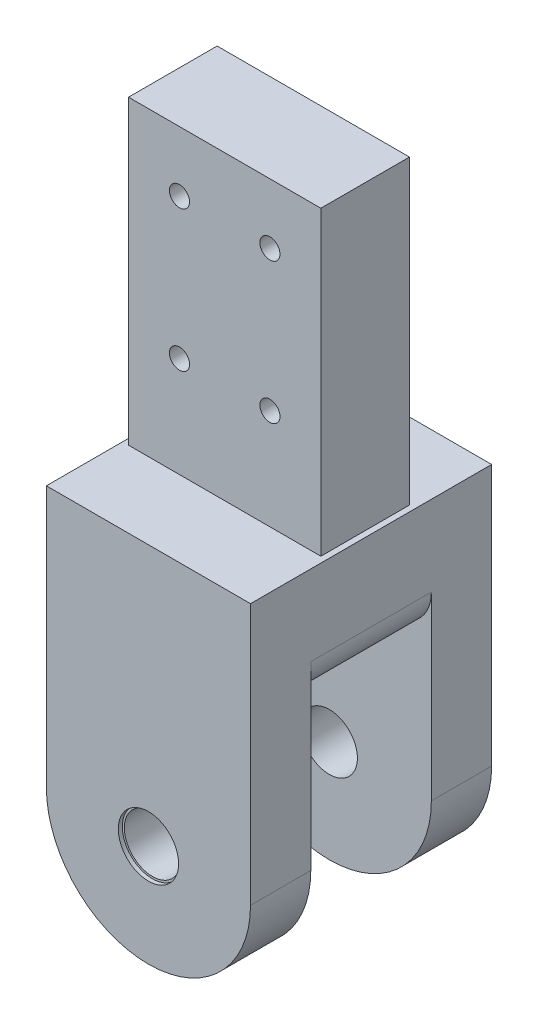
from build123d import *

# Parameters (mm, degrees)
SKETCH1_R           = 7
SKETCH1_R_2         = 2.5
BOSS_EXTRUDE1_DEPTH = 30
SKETCH2_W           = 30
SKETCH2_H           = 60.4
CUT_EXTRUDE1_DEPTH  = 152.923138462
SKETCH3_R           = 7.5
CUT_EXTRUDE2_DEPTH  = 1
CUT_EXTRUDE3_START  = -1
SKETCH4_R           = 7.5
CUT_EXTRUDE3_DEPTH  = 1
SKETCH6_W           = 17.3
SKETCH6_H           = 75
CUT_EXTRUDE4_DEPTH  = 152.923138462
SKETCH7_W           = 50.8
SKETCH7_H           = 25.4
SKETCH7_W_2         = 47.86
SKETCH7_H_2         = 22.05
CUT_EXTRUDE5_DEPTH  = 99.57646778
FILLET1_R           = 10


with BuildPart() as part:
    # Sketch1 → Boss-Extrude1 (new, symmetric)
    with BuildSketch(Plane.XY):
        with BuildLine():
            Line((-25.4, 0), (-25.4, 140))
            Line((-25.4, 140), (25.4, 140))
            Line((25.4, 140), (25.4, 0))
            ThreePointArc((25.4, 0), (0, -25.4), (-25.4, 0))
        make_face()
        Circle(SKETCH1_R, mode=Mode.SUBTRACT)
        with Locations((-11.25, 125)):
            Circle(SKETCH1_R_2, mode=Mode.SUBTRACT)
        with Locations((11.25, 125)):
            Circle(SKETCH1_R_2, mode=Mode.SUBTRACT)
        with Locations((11.25, 90)):
            Circle(SKETCH1_R_2, mode=Mode.SUBTRACT)
        with Locations((-11.25, 90)):
            Circle(SKETCH1_R_2, mode=Mode.SUBTRACT)
    extrude(amount=BOSS_EXTRUDE1_DEPTH, both=True)

    # Sketch2 → Cut-Extrude1 (cut, through all)
    with BuildSketch(Plane(origin=(25.4, 0, 0), x_dir=(0, 0, -1), z_dir=(1, 0, 0))):
        with Locations((0, 4.8)):
            Rectangle(SKETCH2_W, SKETCH2_H)
    extrude(amount=-CUT_EXTRUDE1_DEPTH, mode=Mode.SUBTRACT)

    # Sketch3 → Cut-Extrude2 (cut)
    with BuildSketch(Plane.XY.offset(30)):
        Circle(SKETCH3_R)
    extrude(amount=-CUT_EXTRUDE2_DEPTH, mode=Mode.SUBTRACT)

    # Sketch4 → Cut-Extrude3 (cut)
    with BuildSketch(Plane(origin=(0, 0, -30), x_dir=(-1, 0, 0), z_dir=(0, 0, -1)).offset(CUT_EXTRUDE3_START)):
        Circle(SKETCH4_R)
    extrude(amount=CUT_EXTRUDE3_DEPTH, mode=Mode.SUBTRACT)

    # Sketch6 → Cut-Extrude4 (cut, through all)
    with BuildSketch(Plane(origin=(25.4, 0, 0), x_dir=(0, 0, -1), z_dir=(1, 0, 0))):
        with Locations((-21.35, 102.5)):
            Rectangle(SKETCH6_W, SKETCH6_H)
        with Locations((21.35, 102.5)):
            Rectangle(SKETCH6_W, SKETCH6_H)
    extrude(amount=-CUT_EXTRUDE4_DEPTH, mode=Mode.SUBTRACT)

    # Sketch7 → Cut-Extrude5 (cut, through all)
    with BuildSketch(Plane(origin=(0, 65, 0), x_dir=(1, 0, 0), z_dir=(0, 1, 0))):
        Rectangle(SKETCH7_W, SKETCH7_H)
        Rectangle(SKETCH7_W_2, SKETCH7_H_2, mode=Mode.SUBTRACT)
    extrude(amount=CUT_EXTRUDE5_DEPTH, mode=Mode.SUBTRACT)

    # Fillet1
    fillet1_edges = [part.edges().sort_by_distance(p)[0] for p in [
        (25.4, 35, 0),
        (-25.4, 35, 0),
    ]]
    fillet(fillet1_edges, radius=FILLET1_R)


solid = part.part
